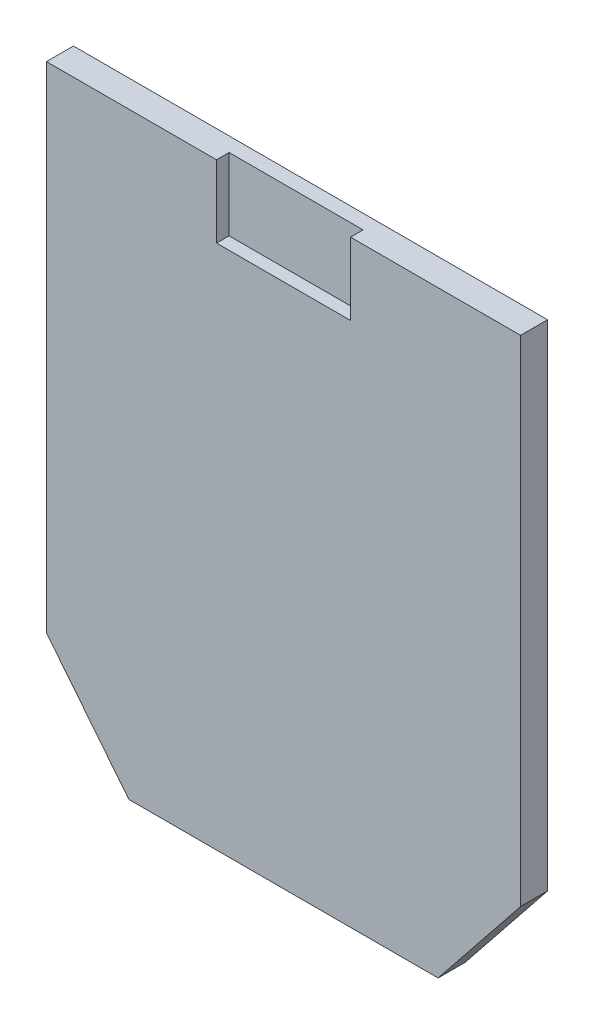
from build123d import *

# Parameters (mm, degrees)
BOSS_EXTRUDE1_DEPTH   = 13.1
FILLET1_R             = 5
SKETCH2_W             = 65
SKETCH2_H             = 35
CUT_EXTRUDE1_DEPTH    = 206.661396475
SKETCH3_W             = 109.473839025
SKETCH3_H             = 48.944636842
BOSS_EXTRUDE2_DEPTH   = 7
BODY_MOVE_COPY1_ANGLE = 180
DELETEFACE1_START     = -1.1
DELETEFACE1_DEPTH     = 13.1


# Read off the part's stored shape, not the designer's step: DeleteFace1
with BuildPart() as part:
    # Sketch1 → Boss-Extrude1 (new body)
    with BuildSketch(Plane.XY):
        Polygon((115, -120), (115, 120), (-115, 120), (-115, -120), (-75, -170), (75, -170), align=None)
    extrude(amount=BOSS_EXTRUDE1_DEPTH)

    # Fillet1
    fillet1_edges = [part.edges().sort_by_distance(p)[0] for p in [
        (-115, 120, 6.55),
        (115, 120, 6.55),
        (115, -120, 6.55),
        (75, -170, 6.55),
        (-75, -170, 6.55),
        (-115, -120, 6.55),
    ]]
    fillet(fillet1_edges, radius=FILLET1_R)

    # Sketch2 → Cut-Extrude1 (cut, through all)
    with BuildSketch(Plane.XY.offset(13.1)):
        with Locations((0, 102.5)):
            Rectangle(SKETCH2_W, SKETCH2_H)
    extrude(amount=-CUT_EXTRUDE1_DEPTH, mode=Mode.SUBTRACT)

    # Sketch3 → Boss-Extrude2 (add)
    with BuildSketch(Plane.XY.offset(13.1)):
        with Locations((2.558327619, 95.527681579)):
            Rectangle(SKETCH3_W, SKETCH3_H)
    extrude(amount=-BOSS_EXTRUDE2_DEPTH)


with BuildPart() as part_1:
    # Body-Move/Copy1: moved
    add(part.part.rotate(Axis((0, 0, 6), (0, 1, 0)), BODY_MOVE_COPY1_ANGLE))

    # DeleteFace1 outline → DeleteFace1 (add)
    with BuildSketch(Plane.XY.offset(DELETEFACE1_START)):
        with BuildLine():
            ThreePointArc((-72.596875763, -170), (-74.762819415, -169.506516182), (-76.50121981, -168.123475238))
            Line((-76.50121981, -168.123475238), (-75, -170))
            Line((-75, -170), (-72.596875763, -170))
        make_face()
        with BuildLine():
            Line((-115, -120), (-113.904344047, -121.369569941))
            ThreePointArc((-113.904344047, -121.369569941), (-114.718141596, -119.90112941), (-115, -118.246094703))
            Line((-115, -118.246094703), (-115, -120))
        make_face()
        with BuildLine():
            ThreePointArc((76.50121981, -168.123475238), (74.762819415, -169.506516182), (72.596875763, -170))
            Line((72.596875763, -170), (75, -170))
            Line((75, -170), (76.50121981, -168.123475238))
        make_face()
        with BuildLine():
            Line((-115, 120), (-115, 115))
            ThreePointArc((-115, 115), (-113.535533906, 118.535533906), (-110, 120))
            Line((-110, 120), (-115, 120))
        make_face()
        with BuildLine():
            ThreePointArc((115, -118.246094703), (114.718141596, -119.90112941), (113.904344047, -121.369569941))
            Line((113.904344047, -121.369569941), (115, -120))
            Line((115, -120), (115, -118.246094703))
        make_face()
        with BuildLine():
            Line((115, 120), (110, 120))
            ThreePointArc((110, 120), (113.535533906, 118.535533906), (115, 115))
            Line((115, 115), (115, 120))
        make_face()
    extrude(amount=DELETEFACE1_DEPTH)


solid = part_1.part
